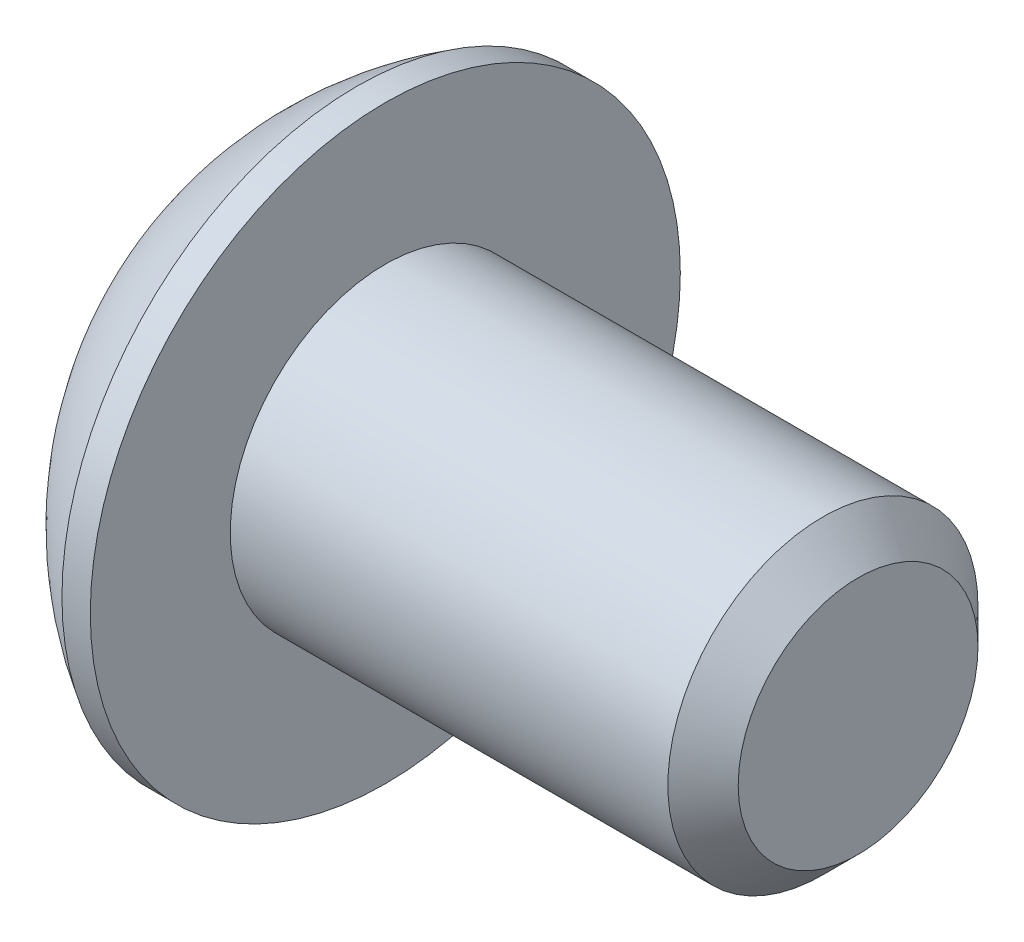
from build123d import *

# Parameters (mm, degrees)
CUT_EXTRUDE1_DEPTH = 1.3208
TAPPED_HOLE1_D     = 2.388
TAPPED_HOLE1_DEPTH = 1.32
TAPPED_HOLE1_TIP   = 0.689356221
CHAMFER1_SIZE      = 0.4724


with BuildPart() as part:
    # Sketch1 → Revolve2 (revolve)
    with BuildSketch(Plane.XY):
        with BuildLine():
            Line((4.2799, 0), (-4.2799, 0))
            Line((-4.2799, 0), (-4.2799, 1.9812))
            ThreePointArc((-4.2799, 1.9812), (-3.514453788, 3.109295804), (-2.4511, 3.9624))
            Line((-2.4511, 3.9624), (-2.0701, 3.9624))
            Line((-2.0701, 3.9624), (-2.0701, 2.0828))
            Line((-2.0701, 2.0828), (4.2799, 2.0828))
            Line((4.2799, 2.0828), (4.2799, 0))
        make_face()
    revolve(axis=Axis((4.2799, 0, 0), (-1, 0, 0)))

    # Sketch9 → Cut-Extrude1 (cut)
    with BuildSketch(Plane.ZY.offset(4.2799)):
        Polygon((0, 1.378481503), (1.1938, 0.689240751), (1.1938, -0.689240751), (0, -1.378481503), (-1.1938, -0.689240751), (-1.1938, 0.689240751), align=None)
    extrude(amount=-CUT_EXTRUDE1_DEPTH, mode=Mode.SUBTRACT)

    # Tapped Hole1
    with Locations(Plane(origin=(-4.2799, 0, 0), x_dir=(0, 0, -1), z_dir=(-1, 0, 0))):
        with Locations((0, 0)):
            Hole(TAPPED_HOLE1_D / 2, depth=TAPPED_HOLE1_DEPTH)
            with Locations((0, 0, -(TAPPED_HOLE1_DEPTH + TAPPED_HOLE1_TIP / 2))):  # 120° drill point
                Cone(0, TAPPED_HOLE1_D / 2, TAPPED_HOLE1_TIP, mode=Mode.SUBTRACT)

    # Chamfer1
    chamfer1_edges = [part.edges().sort_by_distance(p)[0] for p in [
        (4.2799, -2.0828, 0),
    ]]
    chamfer(chamfer1_edges, length=CHAMFER1_SIZE)


solid = part.part
